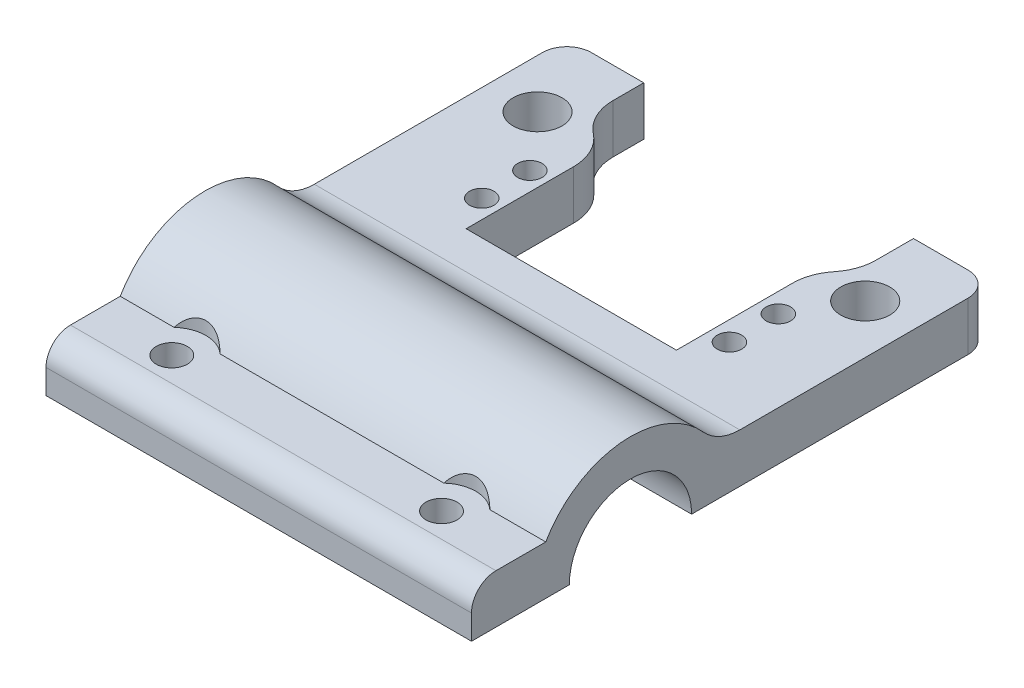
from build123d import *

# Parameters (mm, degrees)
SKETCH1_R           = 5
BOSS_EXTRUDE1_DEPTH = 10
SKETCH3_R           = 2.5
SKETCH3_W           = 43
SKETCH3_H           = 28
CUT_EXTRUDE1_DEPTH  = 126.574678976
FILLET1_R           = 10
FILLET2_R           = 10
BOSS_EXTRUDE2_DEPTH = 87
SKETCH4_4_R         = 12.5
CUT_EXTRUDE3_DEPTH  = 87
FILLET3_R           = 10
SKETCH8_W           = 40
SKETCH8_H           = 23.261660468
CUT_EXTRUDE8_DEPTH  = 87
SKETCH9_W           = 20
SKETCH9_H           = 10
BOSS_EXTRUDE3_DEPTH = 87
FILLET4_R           = 5
SKETCH10_R          = 3.175
CUT_EXTRUDE9_DEPTH  = 126.574678976
FILLET5_R           = 5
SKETCH11_R          = 7
CUT_EXTRUDE10_DEPTH = 126.574678976


with BuildPart() as part:
    # Sketch1 → Boss-Extrude1 (new body)
    with BuildSketch(Plane(origin=(0, 0, 0), x_dir=(1, 0, 0), z_dir=(0, 1, 0))):
        Polygon((0, 90), (15.718723237, 90), (15.718723237, 74), (70.870392539, 74), (70.870392539, 90), (87, 90), (87, 0), (0, 0), align=None)
        with Locations(Location((10, 74, 0), (0, 0, 270))):
            Circle(SKETCH1_R, mode=Mode.SUBTRACT)
        with Locations(Location((77, 74, 0), (0, 0, 270))):
            Circle(SKETCH1_R, mode=Mode.SUBTRACT)
    extrude(amount=BOSS_EXTRUDE1_DEPTH)

    # Sketch3 → Cut-Extrude1 (cut, through all)
    with BuildSketch(Plane(origin=(0, 10, 0), x_dir=(1, 0, 0), z_dir=(0, 1, 0))):
        with Locations(Location((19.6, 53, 0), (0, 0, 270))):
            Circle(SKETCH3_R)
        with Locations(Location((70.4, 62.836666102, 0), (0, 0, 270))):
            Circle(SKETCH3_R)
        with Locations(Location((70.4, 52.836666102, 0), (0, 0, 270))):
            Circle(SKETCH3_R)
        with Locations((44.9, 60)):
            Rectangle(SKETCH3_W, SKETCH3_H)
        with Locations(Location((19.6, 62.836666102, 0), (0, 0, 270))):
            Circle(SKETCH3_R)
    extrude(amount=-CUT_EXTRUDE1_DEPTH, mode=Mode.SUBTRACT)

    # Fillet1
    # the kernel refuses this fillet: 10 mm, written as the material it adds along each edge
    with BuildSketch(Plane(origin=(70.870392539, 0, -74), x_dir=(0, 0, -1), z_dir=(0, 1, 0))) as fillet1_piece_1:
        with BuildLine():
            CenterArc((8.332073051, 10), FILLET1_R, 213.570370594, 56.429629406)
            Line((0, 4.470392539), (-0.166641461, 4.359800389))
            ThreePointArc((-0.166641461, 4.359800389), (-0.2, 2.235196269), (-0.2, 0))
            Line((-0.2, 0), (0, -0.2))
            Line((0, -0.2), (8.332073051, -0.2))
            Line((8.332073051, -0.2), (8.332073051, 0))
        make_face()
    extrude(amount=10)
    with BuildSketch(Plane(origin=(15.718723237, 0, -74), x_dir=(0, 0, -1), z_dir=(0, 1, 0))) as fillet1_piece_2:
        with BuildLine():
            CenterArc((9.727462287, -10), FILLET1_R, 90, 76.592671632)
            Line((0, -7.681276763), (-0.194549246, -7.634902298))
            ThreePointArc((-0.194549246, -7.634902298), (-0.2, -3.840638382), (-0.2, 0))
            Line((-0.2, 0), (0, 0.2))
            Line((0, 0.2), (9.727462287, 0.2))
            Line((9.727462287, 0.2), (9.727462287, 0))
        make_face()
    extrude(amount=10)

    # Fillet2
    fillet2_edges = [part.edges().sort_by_distance(p)[0] for p in [
        (66.4, 5, -74),
        (23.4, 5, -74),
    ]]
    fillet(fillet2_edges, radius=FILLET2_R)

    # Sketch4 → Boss-Extrude2 (add)
    with BuildSketch(Plane(origin=(87, 0, 0), x_dir=(0, 0, -1), z_dir=(1, 0, 0))):
        with BuildLine():
            Line((36, 0), (0, 0))
            Line((0, 0), (0, 10))
            Line((0, 10), (8.5, 10))
            ThreePointArc((8.5, 10), (16, 12.5), (23.5, 10))
            Line((23.5, 10), (33.320508076, 10))
            ThreePointArc((33.320508076, 10), (-3.318516526, -5.176380902), (36, 0))
        make_face()
    extrude(amount=-BOSS_EXTRUDE2_DEPTH)

    # Sketch4<4> → Cut-Extrude3 (cut)
    with BuildSketch(Plane(origin=(87, 0, 0), x_dir=(0, 0, -1), z_dir=(1, 0, 0))):
        with Locations((16, 0)):
            Circle(SKETCH4_4_R)
    extrude(amount=-CUT_EXTRUDE3_DEPTH, mode=Mode.SUBTRACT)

    # Fillet3
    fillet3_edges = [part.edges().sort_by_distance(p)[0] for p in [
        (43.5, 10, -33.320508076),
    ]]
    fillet(fillet3_edges, radius=FILLET3_R)

    # Sketch8 → Cut-Extrude8 (cut)
    with BuildSketch(Plane(origin=(87, 0, 0), x_dir=(0, 0, -1), z_dir=(1, 0, 0))):
        with Locations((16, -11.630830234)):
            Rectangle(SKETCH8_W, SKETCH8_H)
    extrude(amount=-CUT_EXTRUDE8_DEPTH, mode=Mode.SUBTRACT)

    # Sketch9 → Boss-Extrude3 (add)
    with BuildSketch(Plane(origin=(87, 0, 0), x_dir=(0, 0, -1), z_dir=(1, 0, 0))):
        with Locations((-6.5, 5)):
            Rectangle(SKETCH9_W, SKETCH9_H)
    extrude(amount=-BOSS_EXTRUDE3_DEPTH)

    # Fillet4
    fillet4_edges = [part.edges().sort_by_distance(p)[0] for p in [
        (43.5, 10, 16.5),
    ]]
    fillet(fillet4_edges, radius=FILLET4_R)

    # Sketch10 → Cut-Extrude9 (cut, through all)
    with BuildSketch(Plane(origin=(0, 10, 0), x_dir=(1, 0, 0), z_dir=(0, 1, 0))):
        with Locations(Location((15.718723237, -6.5, 0), (0, 0, 270))):
            Circle(SKETCH10_R)
        with Locations(Location((70.870392539, -6.5, 0), (0, 0, 270))):
            Circle(SKETCH10_R)
    extrude(amount=-CUT_EXTRUDE9_DEPTH, mode=Mode.SUBTRACT)

    # Fillet5
    fillet5_edges = [part.edges().sort_by_distance(p)[0] for p in [
        (0, 5, -90),
        (87, 5, -90),
    ]]
    fillet(fillet5_edges, radius=FILLET5_R)

    # Sketch11 → Cut-Extrude10 (cut, through all)
    with BuildSketch(Plane(origin=(0, 10, 0), x_dir=(1, 0, 0), z_dir=(0, 1, 0))):
        with Locations((15.718723237, -6.5)):
            Circle(SKETCH11_R)
        with Locations((70.870392539, -6.5)):
            Circle(SKETCH11_R)
    extrude(amount=CUT_EXTRUDE10_DEPTH, mode=Mode.SUBTRACT)


solid = part.part
